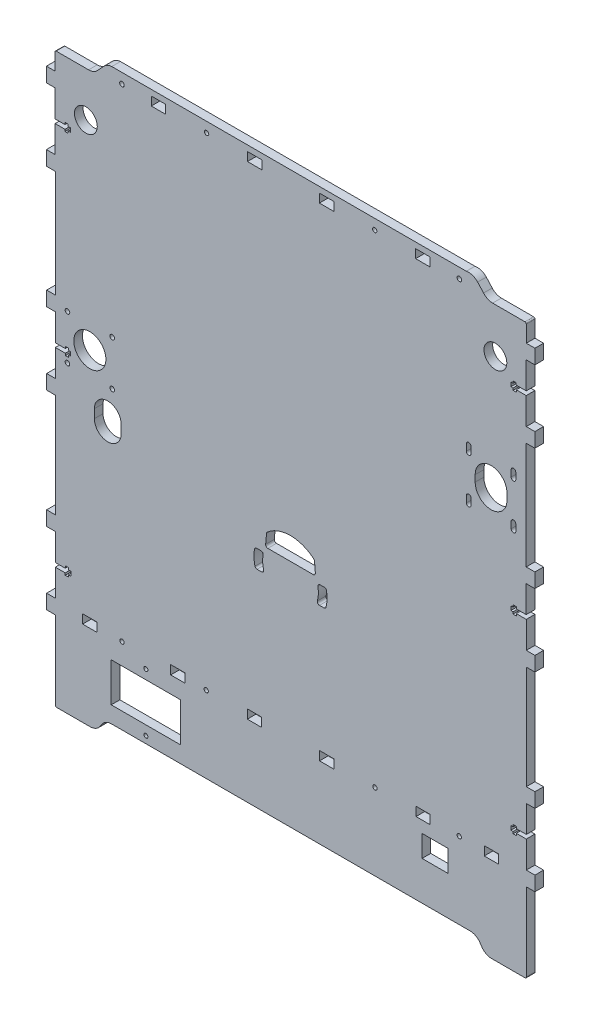
from build123d import *

# Parameters (mm, degrees)
SKETCH_1_R      = 7.9
SKETCH_1_R_2    = 1.6
SKETCH_1_R_3    = 1.5
SKETCH_1_R_4    = 11.1
SKETCH_1_R_5    = 1.4
SKETCH_1_W      = 9.849167497
SKETCH_1_H      = 6.19978722
SKETCH_1_W_2    = 9.849167498
SKETCH_1_H_2    = 6.199787221
SKETCH_1_W_3    = 18
SKETCH_1_H_3    = 15
SKETCH_1_W_4    = 9.849202775
SKETCH_1_W_5    = 48
SKETCH_1_H_4    = 27
SKETCH_1_W_6    = 10
SKETCH_1_H_5    = 6
EXTRUDE_1_DEPTH = 6


with BuildPart() as part:
    # Эскиз1 → Бобышка-Вытянуть1 (new body)
    with BuildSketch(Plane.XY):
        with BuildLine():
            Line((-197.49286399, 21.424334113), (-197.491823461, 20.054248176))
            Line((-197.491823461, 20.054248176), (-195.292063638, 20.054248176))
            Line((-195.292063638, 20.054248176), (-195.292079616, 21.426921304))
            Line((-195.292079616, 21.426921304), (-195.292063638, 21.454129382))
            Line((-195.292063638, 21.454129382), (-193.792063638, 21.454129382))
            Line((-193.792063638, 21.454129382), (-193.792063638, 24.24851002))
            Line((-193.792063638, 24.24851002), (-193.79204766, 24.275718098))
            Line((-193.79204766, 24.275718098), (-195.29204766, 24.275718098))
            Line((-195.29204766, 24.275718098), (-195.292903647, 25.64942725))
            Line((-195.292903647, 25.64942725), (-195.292904307, 25.676635332))
            Line((-195.292904307, 25.676635332), (-197.492904718, 25.676635332))
            Line((-197.492904718, 25.676635332), (-197.492900032, 25.64942725))
            Line((-197.492900032, 25.64942725), (-197.492697556, 24.276635347))
            Line((-197.492697556, 24.276635347), (-204.402139688, 24.276635347))
            Line((-204.402139688, 24.276635347), (-204.402139688, 42.876635347))
            Line((-204.402139688, 42.876635347), (-210.402139688, 42.876635347))
            Line((-210.402139688, 42.876635347), (-210.402139688, 52.876635347))
            Line((-210.402139688, 52.876635347), (-204.402139688, 52.876635347))
            Line((-204.402139688, 52.876635347), (-204.402139688, 127.036635347))
            Line((-204.402139688, 127.036635347), (-210.578198567, 127.036635347))
            Line((-210.578198567, 127.036635347), (-210.578198567, 137.036635347))
            Line((-210.578198567, 137.036635347), (-204.578198567, 137.036635347))
            Line((-204.578198567, 137.036635347), (-204.578198567, 155.636635347))
            Line((-204.578198567, 155.636635347), (-197.666256268, 155.636635347))
            Line((-197.666256268, 155.636635347), (-197.666256268, 154.236531323))
            Line((-197.666256268, 154.236531323), (-195.465433685, 154.236531323))
            Line((-195.465433685, 154.236531323), (-195.465433685, 155.618966061))
            Line((-195.465433685, 155.618966061), (-193.994596268, 155.618966061))
            Line((-193.994596268, 155.618966061), (-193.994596268, 158.418966061))
            Line((-193.994596268, 158.418966061), (-195.497258218, 158.418966061))
            Line((-195.497258218, 158.418966061), (-195.497258218, 159.836635347))
            Line((-195.497258218, 159.836635347), (-197.697258629, 159.836635347))
            Line((-197.697258629, 159.836635347), (-197.697258629, 158.436635347))
            Line((-197.697258629, 158.436635347), (-204.606700761, 158.436635347))
            Line((-204.606700761, 158.436635347), (-204.606700761, 177.036635347))
            Line((-204.606700761, 177.036635347), (-210.578855144, 177.036635347))
            Line((-210.578855144, 177.036635347), (-210.578855144, 187.036635347))
            Line((-210.578855144, 187.036635347), (-204.578855144, 187.036635347))
            Line((-204.578855144, 187.036635347), (-204.578855144, 198.258791497))
            ThreePointArc((-204.578855144, 198.258791497), (-204.470861403, 199.026576962), (-203.81282699, 199.436635347))
            Line((-203.81282699, 199.436635347), (-181.356182497, 199.436635347))
            ThreePointArc((-181.356182497, 199.436635347), (-177.92921467, 200.165852645), (-175.087132372, 202.214860835))
            Line((-175.087132372, 202.214860835), (-170.991579315, 206.694475052))
            ThreePointArc((-170.991579315, 206.694475052), (-168.425909981, 208.607760011), (-165.334585969, 209.436635347))
            Line((-165.334585969, 209.436635347), (80.096257564, 209.436635347))
            ThreePointArc((80.096257564, 209.436635347), (84.366308215, 209.155552649), (87.958266356, 206.829573983))
            Line((87.958266356, 206.829573983), (92.058491377, 202.354235654))
            ThreePointArc((92.058491377, 202.354235654), (94.885860971, 200.232431533), (98.330099636, 199.436635347))
            Line((98.330099636, 199.436635347), (120.701144856, 199.436635347))
            ThreePointArc((120.701144856, 199.436635347), (121.351683095, 199.167173586), (121.621144856, 198.516635347))
            Line((121.621144856, 198.516635347), (121.621144856, 187.036635347))
            Line((121.621144856, 187.036635347), (127.621144856, 187.036635347))
            Line((127.621144856, 187.036635347), (127.621144856, 177.036635347))
            Line((127.621144856, 177.036635347), (121.593299239, 177.036635347))
            Line((121.593299239, 177.036635347), (121.593299239, 158.436635347))
            Line((121.593299239, 158.436635347), (114.681298032, 158.436635347))
            Line((114.681298032, 158.436635347), (114.681298032, 159.836739372))
            Line((114.681298032, 159.836739372), (112.480475449, 159.836739372))
            Line((112.480475449, 159.836739372), (112.481297521, 158.436858407))
            Line((112.481297521, 158.436858407), (110.98129778, 158.435977541))
            Line((110.98129778, 158.435977541), (110.982941525, 155.636894735))
            Line((110.982941525, 155.636894735), (112.482941267, 155.637775601))
            Line((112.482941267, 155.637775601), (112.483763947, 154.236858346))
            Line((112.483763947, 154.236858346), (114.683764362, 154.236805006))
            Line((114.683764362, 154.236805006), (114.683798302, 155.636635347))
            Line((114.683798302, 155.636635347), (121.593299341, 155.636635347))
            Line((121.593299341, 155.636635347), (121.593299341, 137.036635347))
            Line((121.593299341, 137.036635347), (127.565159467, 137.036635347))
            Line((127.565159467, 137.036635347), (127.565159467, 127.036635347))
            Line((127.565159467, 127.036635347), (121.565159467, 127.036635347))
            Line((121.565159467, 127.036635347), (121.565159467, 52.876635347))
            Line((121.565159467, 52.876635347), (127.565159467, 52.876635347))
            Line((127.565159467, 52.876635347), (127.565159467, 42.876635347))
            Line((127.565159467, 42.876635347), (121.561049615, 42.876635347))
            Line((121.561049615, 42.876635347), (121.561049615, 24.276635347))
            Line((121.561049615, 24.276635347), (114.697258416, 24.276635347))
            Line((114.697258416, 24.276635347), (114.697253754, 24.303704553))
            Line((114.697253754, 24.303704553), (114.697017323, 25.676569221))
            Line((114.697017323, 25.676569221), (112.496194744, 25.676190201))
            Line((112.496194744, 25.676190201), (112.497253238, 24.303378605))
            Line((112.497253238, 24.303378605), (112.4972579, 24.276309399))
            Line((112.4972579, 24.276309399), (110.997258333, 24.275170207))
            Line((110.997258333, 24.275170207), (110.999379466, 21.503156931))
            Line((110.999379466, 21.503156931), (110.999384128, 21.476087726))
            Line((110.999384128, 21.476087726), (112.499383696, 21.477226918))
            Line((112.499383696, 21.477226918), (112.500442976, 20.103379031))
            Line((112.500442976, 20.103379031), (112.500447638, 20.076309825))
            Line((112.500447638, 20.076309825), (114.700448025, 20.076635363))
            Line((114.700448025, 20.076635363), (114.700443364, 20.103704568))
            Line((114.700443364, 20.103704568), (114.700240865, 21.476635347))
            Line((114.700240865, 21.476635347), (121.609741905, 21.476635347))
            Line((121.609741905, 21.476635347), (121.609741905, 2.876635347))
            Line((121.609741905, 2.876635347), (127.612060696, 2.876635347))
            Line((127.612060696, 2.876635347), (127.612060696, -7.123364653))
            Line((127.612060696, -7.123364653), (121.612060696, -7.123364653))
            Line((121.612060696, -7.123364653), (121.612060696, -78.853364653))
            Line((121.612060696, -78.853364653), (127.612060696, -78.853364653))
            Line((127.612060696, -78.853364653), (127.612060696, -88.853364653))
            Line((127.612060696, -88.853364653), (121.700067464, -88.853364653))
            Line((121.700067464, -88.853364653), (121.700067464, -107.433364653))
            Line((121.700067464, -107.433364653), (114.700066257, -107.433364653))
            Line((114.700066257, -107.433364653), (114.700066257, -106.033260628))
            Line((114.700066257, -106.033260628), (112.499243675, -106.033260628))
            Line((112.499243675, -106.033260628), (112.500065747, -107.433141593))
            Line((112.500065747, -107.433141593), (111.000066006, -107.434022459))
            Line((111.000066006, -107.434022459), (111.001709751, -110.233105265))
            Line((111.001709751, -110.233105265), (112.501709492, -110.232224399))
            Line((112.501709492, -110.232224399), (112.502532173, -111.633141654))
            Line((112.502532173, -111.633141654), (114.705737205, -111.633195072))
            Line((114.705737205, -111.633195072), (114.705771144, -110.233364653))
            Line((114.705771144, -110.233364653), (121.615272184, -110.233364653))
            Line((121.615272184, -110.233364653), (121.615272184, -128.843364653))
            Line((121.615272184, -128.843364653), (127.615272184, -128.843364653))
            Line((127.615272184, -128.843364653), (127.615272184, -138.843364653))
            Line((127.615272184, -138.843364653), (121.791768054, -138.843364653))
            Line((121.791768054, -138.843364653), (121.791768054, -192.691567269))
            ThreePointArc((121.791768054, -192.691567269), (121.486962755, -193.522980149), (120.669471449, -193.863364653))
            Line((120.669471449, -193.863364653), (97.669079588, -193.863364653))
            ThreePointArc((97.669079588, -193.863364653), (94.116647531, -193.044338241), (91.239822569, -190.805040153))
            Line((91.239822569, -190.805040153), (89.183118423, -187.785387058))
            ThreePointArc((89.183118423, -187.785387058), (86.263995882, -185.545465551), (82.671740657, -184.74908174))
            Line((82.671740657, -184.74908174), (-165.296570174, -184.74908174))
            ThreePointArc((-165.296570174, -184.74908174), (-168.888409421, -185.547339588), (-171.806362957, -187.788783751))
            Line((-171.806362957, -187.788783751), (-173.861491415, -190.809509456))
            ThreePointArc((-173.861491415, -190.809509456), (-176.776975894, -193.057976183), (-180.36960749, -193.863364653))
            Line((-180.36960749, -193.863364653), (-203.495751054, -193.863364653))
            ThreePointArc((-203.495751054, -193.863364653), (-204.183217651, -193.530146952), (-204.408187552, -192.800055928))
            Line((-204.408187552, -192.800055928), (-204.436337757, -138.843364653))
            Line((-204.436337757, -138.843364653), (-210.436337757, -138.843364653))
            Line((-210.436337757, -138.843364653), (-210.436337757, -128.843364653))
            Line((-210.436337757, -128.843364653), (-204.441599541, -128.843364653))
            Line((-204.441599541, -128.843364653), (-204.441599541, -110.233364653))
            Line((-204.441599541, -110.233364653), (-197.529183482, -110.233364653))
            Line((-197.529183482, -110.233364653), (-197.528934177, -111.68096837))
            Line((-197.528934177, -111.68096837), (-195.340274898, -111.679449577))
            Line((-195.340274898, -111.679449577), (-195.342068048, -110.279844178))
            Line((-195.342068048, -110.279844178), (-193.683176528, -110.277769726))
            Line((-193.683176528, -110.277769726), (-193.688517574, -107.284374899))
            Line((-193.688517574, -107.284374899), (-195.333363112, -107.286501137))
            Line((-195.333363112, -107.286501137), (-195.335203884, -105.895501094))
            Line((-195.335203884, -105.895501094), (-197.496109177, -105.897039343))
            Line((-197.496109177, -105.897039343), (-197.495881843, -107.433364653))
            Line((-197.495881843, -107.433364653), (-204.405323975, -107.433364653))
            Line((-204.405323975, -107.433364653), (-204.405323975, -88.853364653))
            Line((-204.405323975, -88.853364653), (-210.405323975, -88.853364653))
            Line((-210.405323975, -88.853364653), (-210.405323975, -78.853364653))
            Line((-210.405323975, -78.853364653), (-204.405323975, -78.853364653))
            Line((-204.405323975, -78.853364653), (-204.405323975, -7.123364653))
            Line((-204.405323975, -7.123364653), (-210.405323975, -7.123364653))
            Line((-210.405323975, -7.123364653), (-210.405323975, 2.876635347))
            Line((-210.405323975, 2.876635347), (-204.405323975, 2.876635347))
            Line((-204.405323975, 2.876635347), (-204.405323975, 21.456635347))
            Line((-204.405323975, 21.456635347), (-204.405323975, 21.476635347))
            Line((-204.405323975, 21.476635347), (-197.492903711, 21.476635347))
            Line((-197.492903711, 21.476635347), (-197.49286399, 21.424334113))
        make_face()
        with Locations((-183.256700761, 168.436635347)):
            Circle(SKETCH_1_R, mode=Mode.SUBTRACT)
        with Locations((100.243299239, 168.436635347)):
            Circle(SKETCH_1_R, mode=Mode.SUBTRACT)
        with Locations((-158.278855144, 202.436635347)):
            Circle(SKETCH_1_R_2, mode=Mode.SUBTRACT)
        with Locations((75.321144856, 202.436635347)):
            Circle(SKETCH_1_R_2, mode=Mode.SUBTRACT)
        with Locations((16.721144856, 202.436635347)):
            Circle(SKETCH_1_R_3, mode=Mode.SUBTRACT)
        with Locations((-99.678855144, 202.436635347)):
            Circle(SKETCH_1_R_3, mode=Mode.SUBTRACT)
        with Locations((-196.006387984, 47.305988871)):
            Circle(SKETCH_1_R_2, mode=Mode.SUBTRACT)
        with Locations((-165.006387984, 16.305988871)):
            Circle(SKETCH_1_R_2, mode=Mode.SUBTRACT)
        with Locations((-196.006387984, 16.305988871)):
            Circle(SKETCH_1_R_2, mode=Mode.SUBTRACT)
        with Locations((-180.506387984, 31.805988871)):
            Circle(SKETCH_1_R_4, mode=Mode.SUBTRACT)
        with Locations((-165.006387984, 47.305988871)):
            Circle(SKETCH_1_R_2, mode=Mode.SUBTRACT)
        with Locations((75.231627835, -131.73058328)):
            Circle(SKETCH_1_R_3, mode=Mode.SUBTRACT)
        with Locations((16.844053889, -131.689395817)):
            Circle(SKETCH_1_R_3, mode=Mode.SUBTRACT)
        with Locations((-99.94326742, -131.731436982)):
            Circle(SKETCH_1_R_3, mode=Mode.SUBTRACT)
        with Locations((-158.278561228, -131.767100286)):
            Circle(SKETCH_1_R_3, mode=Mode.SUBTRACT)
        with Locations((-141.692424291, -179.94908174)):
            Circle(SKETCH_1_R_5, mode=Mode.SUBTRACT)
        with Locations((-141.692424291, -139.94908174)):
            Circle(SKETCH_1_R_5, mode=Mode.SUBTRACT)
        with Locations((-16.561450589, -131.812904739)):
            Rectangle(SKETCH_1_W, SKETCH_1_H, mode=Mode.SUBTRACT)
        with Locations((-66.561491687, -131.811528906)):
            Rectangle(SKETCH_1_W_2, SKETCH_1_H_2, mode=Mode.SUBTRACT)
        with Locations((58.493612016, -150.412798349)):
            Rectangle(SKETCH_1_W_3, SKETCH_1_H_3, mode=Mode.SUBTRACT)
        with Locations((-119.607010424, -131.812904739)):
            Rectangle(SKETCH_1_W_4, SKETCH_1_H, mode=Mode.SUBTRACT)
        with Locations((-180.575547631, -131.812904739)):
            Rectangle(SKETCH_1_W_4, SKETCH_1_H, mode=Mode.SUBTRACT)
        with Locations((97.458461467, -131.812904739)):
            Rectangle(SKETCH_1_W_4, SKETCH_1_H, mode=Mode.SUBTRACT)
        with Locations((50.213120923, -131.812904739)):
            Rectangle(SKETCH_1_W_4, SKETCH_1_H, mode=Mode.SUBTRACT)
        with BuildLine():
            Line((-18.134599873, -29.194011129), (-21.184312759, -29.194011129))
            ThreePointArc((-21.184312759, -29.194011129), (-22.342493839, -29.740797309), (-22.65630504, -30.982522347))
            ThreePointArc((-22.65630504, -30.982522347), (-22.309250666, -35.408837109), (-22.983068573, -39.797308203))
            ThreePointArc((-22.983068573, -39.797308203), (-22.72917458, -41.103666451), (-21.536477135, -41.694011129))
            Line((-21.536477135, -41.694011129), (-18.440328783, -41.694011129))
            ThreePointArc((-18.440328783, -41.694011129), (-17.510284763, -41.370879057), (-16.980943477, -40.540701957))
            ThreePointArc((-16.980943477, -40.540701957), (-16.309095275, -35.507678983), (-16.655943039, -30.441872344))
            ThreePointArc((-16.655943039, -30.441872344), (-17.167182739, -29.547667337), (-18.134599873, -29.194011129))
        make_face(mode=Mode.SUBTRACT)
        with BuildLine():
            Line((-64.7445198, -41.694011128), (-61.648371447, -41.694011128))
            ThreePointArc((-61.648371447, -41.694011128), (-60.455674003, -41.103666451), (-60.201780009, -39.797308203))
            ThreePointArc((-60.201780009, -39.797308203), (-60.875597917, -35.408837109), (-60.528543542, -30.982522347))
            ThreePointArc((-60.528543542, -30.982522347), (-60.842354744, -29.740797309), (-62.000535824, -29.194011129))
            Line((-62.000535824, -29.194011129), (-65.05024871, -29.194011129))
            ThreePointArc((-65.05024871, -29.194011129), (-66.017665844, -29.547667337), (-66.528905544, -30.441872344))
            ThreePointArc((-66.528905544, -30.441872344), (-66.875753307, -35.507678983), (-66.203905105, -40.540701957))
            ThreePointArc((-66.203905105, -40.540701957), (-65.67456382, -41.370879057), (-64.7445198, -41.694011128))
        make_face(mode=Mode.SUBTRACT)
        with BuildLine():
            Line((-58.18830834, -16.824477467), (-58.795688036, -23.766859164))
            ThreePointArc((-58.795688036, -23.766859164), (-58.407311994, -24.91097809), (-57.301395989, -25.397592779))
            Line((-57.301395989, -25.397592779), (-25.883452594, -25.397592779))
            ThreePointArc((-25.883452594, -25.397592779), (-24.777536589, -24.91097809), (-24.389160547, -23.766859164))
            Line((-24.389160547, -23.766859164), (-24.996540243, -16.824477467))
            ThreePointArc((-24.996540243, -16.824477467), (-25.15785371, -16.267338924), (-25.518477328, -15.813052674))
            ThreePointArc((-25.518477328, -15.813052674), (-41.592424291, -9.897592775), (-57.666371255, -15.813052674))
            ThreePointArc((-57.666371255, -15.813052674), (-58.026994873, -16.267338924), (-58.18830834, -16.824477467))
        make_face(mode=Mode.SUBTRACT)
        with Locations((-141.692424291, -159.912798349)):
            Rectangle(SKETCH_1_W_5, SKETCH_1_H_4, mode=Mode.SUBTRACT)
        with Locations((-132.978855144, 202.436635347)):
            Rectangle(SKETCH_1_W_6, SKETCH_1_H_5, mode=Mode.SUBTRACT)
        with Locations((50.021144856, 202.436635347)):
            Rectangle(SKETCH_1_W_6, SKETCH_1_H_5, mode=Mode.SUBTRACT)
        with Locations((-66.378855144, 202.436635347)):
            Rectangle(SKETCH_1_W_6, SKETCH_1_H_5, mode=Mode.SUBTRACT)
        with Locations((-16.578855144, 202.436635347)):
            Rectangle(SKETCH_1_W_6, SKETCH_1_H_5, mode=Mode.SUBTRACT)
        with BuildLine():
            Line((-158.856387984, -7.694011129), (-158.856387984, -1.694011129))
            ThreePointArc((-158.856387984, -1.694011129), (-168.106387984, 7.555988871), (-177.356387984, -1.694011129))
            Line((-177.356387984, -1.694011129), (-177.356387984, -7.694011129))
            ThreePointArc((-177.356387984, -7.694011129), (-168.106387984, -16.944011129), (-158.856387984, -7.694011129))
        make_face(mode=Mode.SUBTRACT)
        with BuildLine():
            Line((86.257214298, 90.555988871), (86.257214298, 86.055988871))
            ThreePointArc((86.257214298, 86.055988871), (97.257214298, 75.055988871), (108.257214298, 86.055988871))
            Line((108.257214298, 86.055988871), (108.257214298, 90.555988871))
            ThreePointArc((108.257214298, 90.555988871), (97.257214298, 101.555988871), (86.257214298, 90.555988871))
        make_face(mode=Mode.SUBTRACT)
        with BuildLine():
            Line((111.157214298, 75.055988871), (111.157214298, 70.555988871))
            ThreePointArc((111.157214298, 70.555988871), (112.757214298, 68.955988871), (114.357214298, 70.555988871))
            Line((114.357214298, 70.555988871), (114.357214298, 75.055988871))
            ThreePointArc((114.357214298, 75.055988871), (112.757214298, 76.655988871), (111.157214298, 75.055988871))
        make_face(mode=Mode.SUBTRACT)
        with BuildLine():
            Line((114.357214298, 101.555988871), (114.357214298, 106.055988871))
            ThreePointArc((114.357214298, 106.055988871), (112.757214298, 107.655988871), (111.157214298, 106.055988871))
            Line((111.157214298, 106.055988871), (111.157214298, 101.555988871))
            ThreePointArc((111.157214298, 101.555988871), (112.757214298, 99.955988871), (114.357214298, 101.555988871))
        make_face(mode=Mode.SUBTRACT)
        with BuildLine():
            Line((80.157214298, 75.055988871), (80.157214298, 70.555988871))
            ThreePointArc((80.157214298, 70.555988871), (81.757214298, 68.955988871), (83.357214298, 70.555988871))
            Line((83.357214298, 70.555988871), (83.357214298, 75.055988871))
            ThreePointArc((83.357214298, 75.055988871), (81.757214298, 76.655988871), (80.157214298, 75.055988871))
        make_face(mode=Mode.SUBTRACT)
        with BuildLine():
            Line((83.357214298, 101.555988871), (83.357214298, 106.055988871))
            ThreePointArc((83.357214298, 106.055988871), (81.757214298, 107.655988871), (80.157214298, 106.055988871))
            Line((80.157214298, 106.055988871), (80.157214298, 101.555988871))
            ThreePointArc((80.157214298, 101.555988871), (81.757214298, 99.955988871), (83.357214298, 101.555988871))
        make_face(mode=Mode.SUBTRACT)
    extrude(amount=EXTRUDE_1_DEPTH)


solid = part.part
